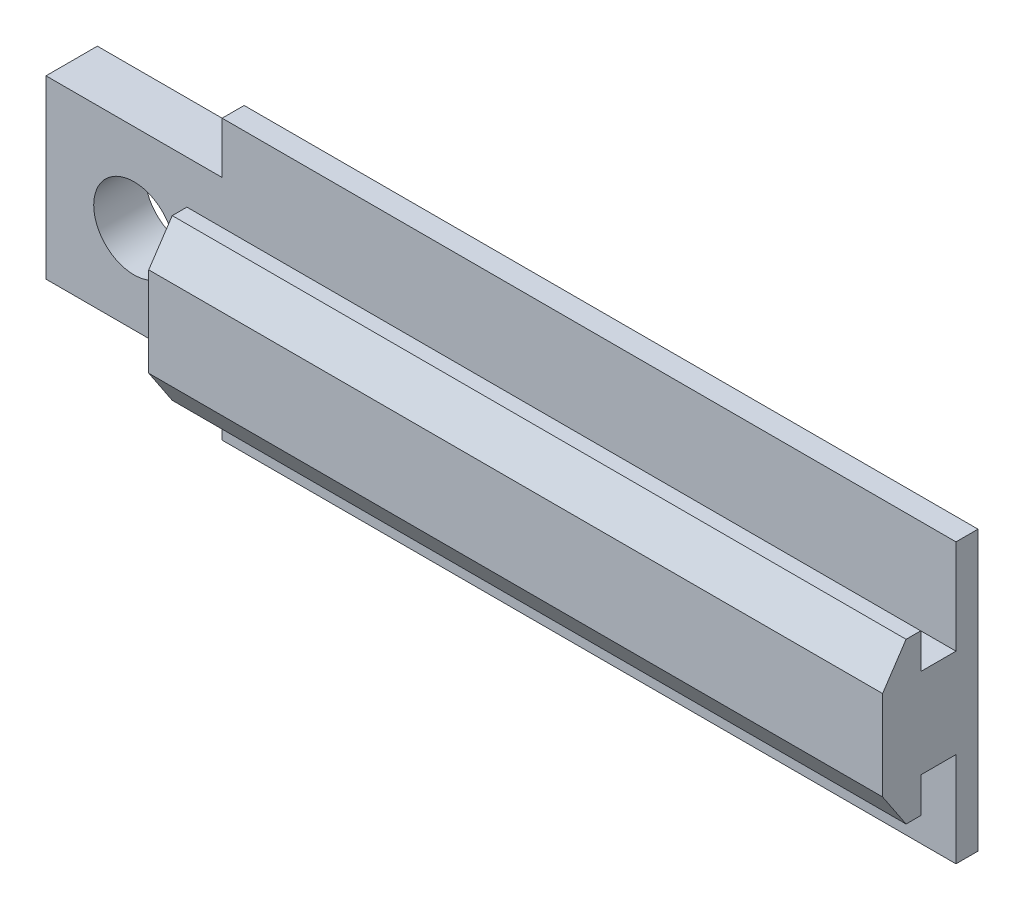
from build123d import *

# Parameters (mm, degrees)
SKETCH1_W               = 50
SKETCH1_H               = 6.5
BOSS_EXTRUDE1_DEPTH     = 19
CUT_EXTRUDE1_DEPTH      = 54.586962034
CUT_EXTRUDE1_DEPTH_BACK = 54.586962034
SKETCH3_W               = 3.5
SKETCH3_H               = 12
BOSS_EXTRUDE2_DEPTH     = 12
CUT_EXTRUDE2_REACH      = 44.453
SKETCH4_R               = 2.75


with BuildPart() as part:
    # Sketch1 → Boss-Extrude1 (new body)
    with BuildSketch(Plane(origin=(0, 0, 0), x_dir=(1, 0, 0), z_dir=(0, 1, 0))):
        Rectangle(SKETCH1_W, SKETCH1_H)
    extrude(amount=BOSS_EXTRUDE1_DEPTH)

    # Sketch2 → Cut-Extrude1 (cut, two sides: drawn at the far end of the back side and taken through both)
    with BuildSketch(Plane(origin=(25, 0, 0), x_dir=(0, 0, -1), z_dir=(1, 0, 0)).offset(-CUT_EXTRUDE1_DEPTH_BACK)):
        Polygon((1.75, 68.293765409), (1.75, 19), (1.75, 12.55), (-0.65, 12.55), (-0.65, 14.95), (-1.65, 14.95), (-3.25, 12.55), (-3.25, 6.45), (-1.65, 4.05), (-0.65, 4.05), (-0.65, 6.45), (1.75, 6.45), (1.75, 0), (1.75, -49.293765409), (-96.837530818, -49.293765409), (-96.837530818, 68.293765409), align=None)
    extrude(amount=CUT_EXTRUDE1_DEPTH + CUT_EXTRUDE1_DEPTH_BACK, mode=Mode.SUBTRACT)

    # Sketch3 → Boss-Extrude2 (add)
    with BuildSketch(Plane.ZY.offset(25)):
        with Locations((-3.5, 9.5)):
            Rectangle(SKETCH3_W, SKETCH3_H)
    extrude(amount=BOSS_EXTRUDE2_DEPTH)

    # Sketch4 → Cut-Extrude2 (cut, up to next)
    with BuildSketch(Plane(origin=(0, 0, -5.25), x_dir=(-1, 0, 0), z_dir=(0, 0, -1)), mode=Mode.PRIVATE) as cut_extrude2_sk1:
        with Locations((31, 9.5)):
            Circle(SKETCH4_R)
    cut_extrude2_tool1 = extrude(cut_extrude2_sk1.sketch, amount=-CUT_EXTRUDE2_REACH, mode=Mode.PRIVATE) & part.part
    add(cut_extrude2_tool1.solids().sort_by_distance((-31, 9.5, -5.25))[0], mode=Mode.SUBTRACT)


solid = part.part
